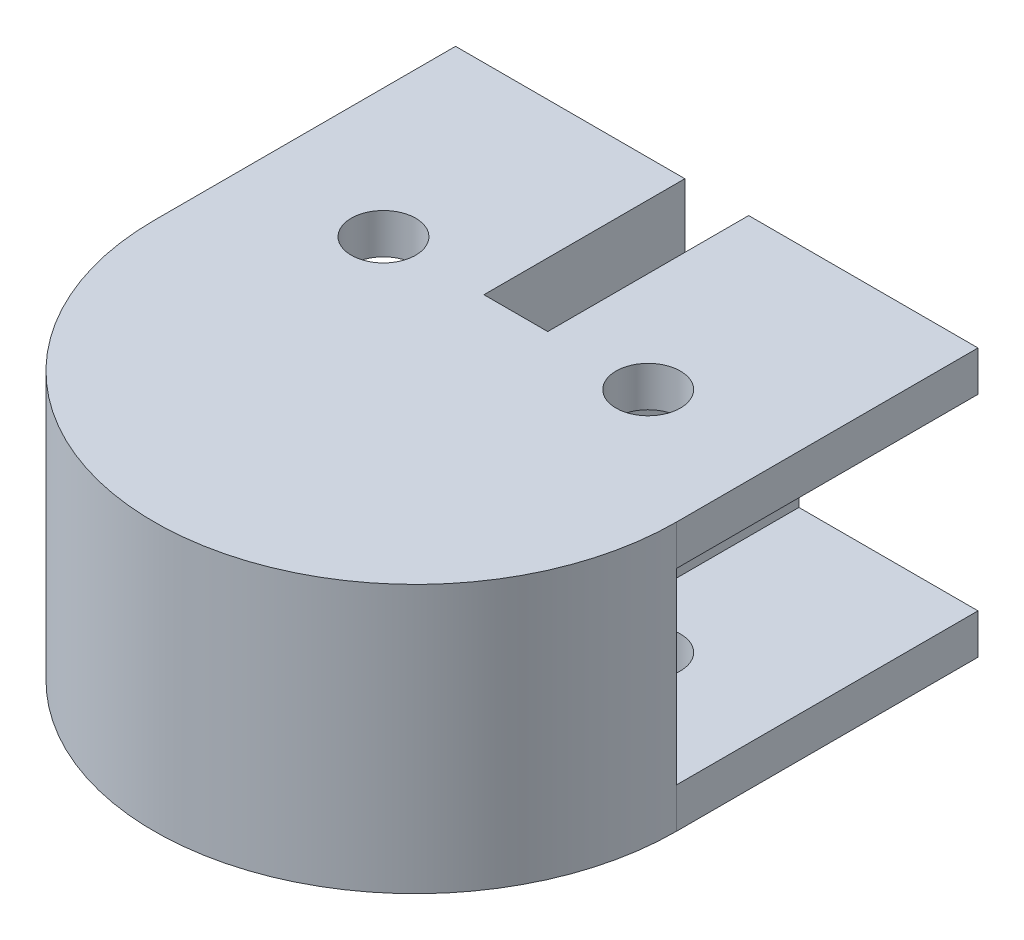
from build123d import *

# Parameters (mm, degrees)
SKETCH1_R           = 1.6
BOSS_EXTRUDE1_DEPTH = 2
BOSS_EXTRUDE3_START = 4.665
BOSS_EXTRUDE3_DEPTH = 4.665


with BuildPart() as part:
    # Sketch1 → Boss-Extrude1 (new body)
    with BuildSketch(Plane(origin=(0, 0, 0), x_dir=(1, 0, 0), z_dir=(0, 1, 0))):
        with BuildLine():
            Line((-1.5875, 0), (1.5875, 0))
            Line((1.5875, 0), (1.5875, 10))
            Line((1.5875, 10), (13, 10))
            Line((13, 10), (13, -5))
            ThreePointArc((13, -5), (0, -18), (-13, -5))
            Line((-13, -5), (-13, 10))
            Line((-13, 10), (-1.5875, 10))
            Line((-1.5875, 10), (-1.5875, 0))
        make_face()
        with Locations((6.5875, 0)):
            Circle(SKETCH1_R, mode=Mode.SUBTRACT)
        with Locations((-6.5875, 0)):
            Circle(SKETCH1_R, mode=Mode.SUBTRACT)
    boss_extrude1 = extrude(amount=BOSS_EXTRUDE1_DEPTH)

    # Sketch3 → Boss-Extrude3 (add)
    with BuildSketch(Plane.XZ.offset(BOSS_EXTRUDE3_START)):
        with BuildLine():
            Line((4.0875, -10), (1.5875, -10))
            Line((1.5875, -10), (1.5875, 0))
            Line((1.5875, 0), (-1.5875, 0))
            Line((-1.5875, 0), (-1.5875, -10))
            Line((-1.5875, -10), (-4.0875, -10))
            Line((-4.0875, -10), (-4.0875, 5))
            Line((-4.0875, 5), (-13, 5))
            ThreePointArc((-13, 5), (0, 18), (13, 5))
            Line((13, 5), (4.0875, 5))
            Line((4.0875, 5), (4.0875, -10))
        make_face()
    boss_extrude3 = extrude(amount=-BOSS_EXTRUDE3_DEPTH)

    # Mirror11: Boss-Extrude3 across plane
    add(boss_extrude3.mirror(Plane(origin=(0, -4.665, 0), x_dir=(0, 0, 1), z_dir=(0, -1, 0))))

    # Mirror12: Boss-Extrude1 across plane
    add(boss_extrude1.mirror(Plane(origin=(0, -4.665, 0), x_dir=(0, 0, 1), z_dir=(0, -1, 0))))


solid = part.part
